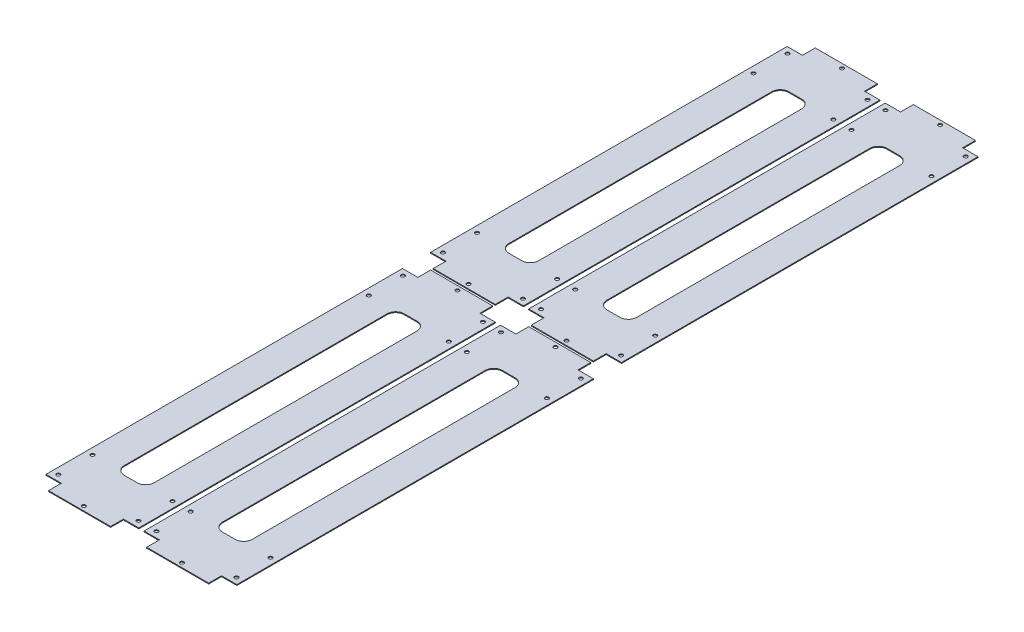
from build123d import *

# Parameters (mm, degrees)
SKETCH1_R           = 2.15
SKETCH1_W           = 35
SKETCH1_H           = 328.176136612
BOSS_EXTRUDE1_DEPTH = 1
FILLET2_R           = 10
LPATTERN2_COUNT     = 2
LPATTERN2_PITCH     = 115
LPATTERN2_2_COUNT   = 2
LPATTERN2_2_PITCH   = 451


with BuildPart() as part:
    # Sketch1 → Boss-Extrude1 (new body)
    with BuildSketch(Plane(origin=(0, 0, 0), x_dir=(1, 0, 0), z_dir=(0, 1, 0))):
        Polygon((-54.4, -208.995), (-36.4, -208.995), (-36.4, -223.995), (36.4, -223.995), (36.4, -208.995), (54.4, -208.995), (54.4, 208.995), (36.4, 208.995), (36.4, 223.995), (-36.4, 223.995), (-36.4, 208.995), (-54.4, 208.995), align=None)
        with Locations((-46.9, 161.995)):
            Circle(SKETCH1_R, mode=Mode.SUBTRACT)
        with Locations((46.9, 161.995)):
            Circle(SKETCH1_R, mode=Mode.SUBTRACT)
        with Locations((-46.9, -161.995)):
            Circle(SKETCH1_R, mode=Mode.SUBTRACT)
        with Locations((46.9, -161.995)):
            Circle(SKETCH1_R, mode=Mode.SUBTRACT)
        with Locations((-46.9, -201.995)):
            Circle(SKETCH1_R, mode=Mode.SUBTRACT)
        with Locations((46.9, -201.995)):
            Circle(SKETCH1_R, mode=Mode.SUBTRACT)
        with Locations((46.9, 201.995)):
            Circle(SKETCH1_R, mode=Mode.SUBTRACT)
        with Locations((-46.9, 201.995)):
            Circle(SKETCH1_R, mode=Mode.SUBTRACT)
        with Locations((0, 218.995)):
            Circle(SKETCH1_R, mode=Mode.SUBTRACT)
        with Locations((0, -218.995)):
            Circle(SKETCH1_R, mode=Mode.SUBTRACT)
        Rectangle(SKETCH1_W, SKETCH1_H, mode=Mode.SUBTRACT)
    extrude(amount=BOSS_EXTRUDE1_DEPTH)

    # Fillet2
    fillet2_edges = [part.edges().sort_by_distance(p)[0] for p in [
        (17.5, 0.5, -164.088068306),
        (-17.5, 0.5, -164.088068306),
        (17.5, 0.5, 164.088068306),
        (-17.5, 0.5, 164.088068306),
    ]]
    fillet(fillet2_edges, radius=FILLET2_R)


with BuildPart() as lpattern2_1:
    # LPattern2: pattern copy
    add(part.part.moved(Location(Vector(1, 0, 0) * (1 * LPATTERN2_PITCH))))


with BuildPart() as lpattern2_2_1:
    # LPattern2 2: pattern copy
    add(part.part.moved(Location(Vector(0, 0, -1) * (1 * LPATTERN2_2_PITCH))))


with BuildPart() as lpattern2_2_2:
    # LPattern2 2: pattern copy
    add(lpattern2_1.part.moved(Location(Vector(0, 0, -1) * (1 * LPATTERN2_2_PITCH))))


solid = Compound([part.part, lpattern2_1.part, lpattern2_2_1.part, lpattern2_2_2.part])
